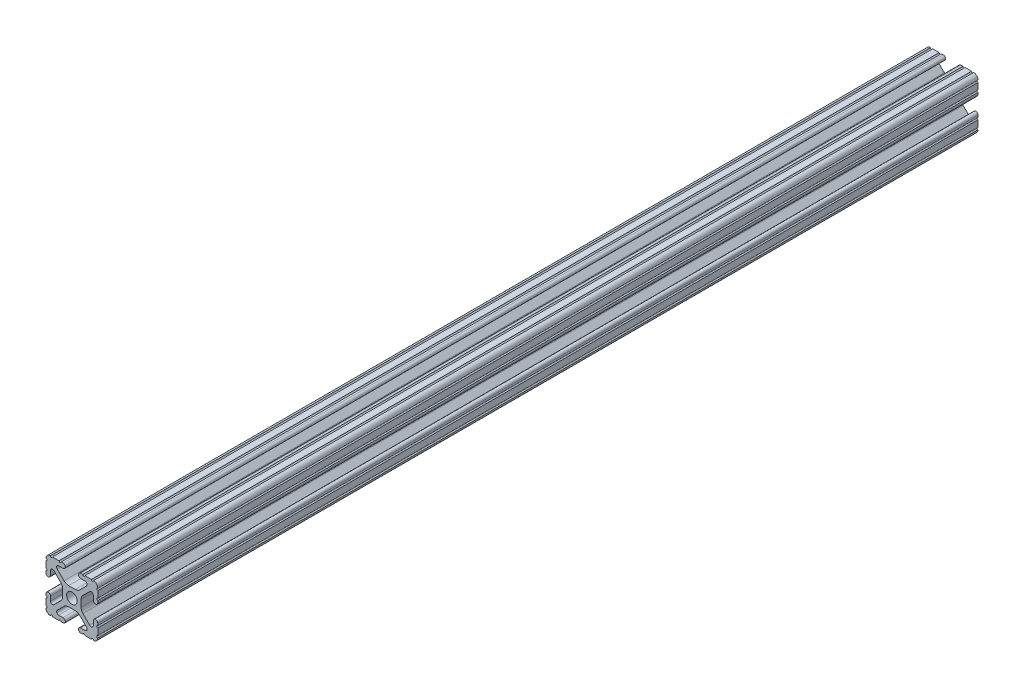
from build123d import *

# Parameters (mm, degrees)
SKETCH1_R           = 2.6035
BOSS_EXTRUDE1_DEPTH = 1270
SKETCH6_W           = 122.666969327
SKETCH6_H           = 109.347800906
CUT_EXTRUDE1_DEPTH  = 699.730870937
SKETCH7_W           = 29.67741712
SKETCH7_H           = 27.72917189
CUT_EXTRUDE2_DEPTH  = 266.7


with BuildPart() as part:
    # Sketch1 → Boss-Extrude1 (new body)
    with BuildSketch(Plane(origin=(0, 0, -1270), x_dir=(-1, 0, 0), z_dir=(0, 0, -1))):
        with BuildLine():
            Line((12.7, -9.5504), (12.7, -6.3330836))
            ThreePointArc((12.7, -6.3330836), (12.192, -5.8250836), (12.7, -5.3170836))
            Line((12.7, -5.3170836), (12.7, -4.3434))
            ThreePointArc((12.7, -4.3434), (11.5951, -3.2385), (10.4902, -4.3434))
            Line((10.4902, -4.3434), (10.4902, -6.474794456))
            ThreePointArc((10.4902, -6.474794456), (9.863006367, -7.413456061), (8.75577951, -7.193214945))
            Line((8.75577951, -7.193214945), (5.42573597, -3.863171405))
            ThreePointArc((5.42573597, -3.863171405), (4.737482484, -2.833127272), (4.4958, -1.618107374))
            Line((4.4958, -1.618107374), (4.4958, 1.618107374))
            ThreePointArc((4.4958, 1.618107374), (4.737482484, 2.833127272), (5.42573597, 3.863171405))
            Line((5.42573597, 3.863171405), (8.75577951, 7.193214945))
            ThreePointArc((8.75577951, 7.193214945), (9.863006367, 7.413456061), (10.4902, 6.474794456))
            Line((10.4902, 6.474794456), (10.4902, 4.343399971))
            ThreePointArc((10.4902, 4.343399971), (11.5951, 3.238499971), (12.7, 4.343399971))
            Line((12.7, 4.343399971), (12.7, 5.3170836))
            ThreePointArc((12.7, 5.3170836), (12.192, 5.8250836), (12.7, 6.3330836))
            Line((12.7, 6.3330836), (12.7, 9.5504))
            ThreePointArc((12.7, 9.5504), (12.192000006, 10.058323491), (12.699846982, 10.566399977))
            ThreePointArc((12.699846982, 10.566399977), (12.082522516, 12.082522516), (10.566399977, 12.699846982))
            ThreePointArc((10.566399977, 12.699846982), (10.058323491, 12.192000006), (9.5504, 12.7))
            Line((9.5504, 12.7), (6.3330836, 12.7))
            ThreePointArc((6.3330836, 12.7), (5.8250836, 12.192), (5.3170836, 12.7))
            Line((5.3170836, 12.7), (4.3434, 12.7))
            ThreePointArc((4.3434, 12.7), (3.2385, 11.5951), (4.3434, 10.4902))
            Line((4.3434, 10.4902), (6.474794456, 10.4902))
            ThreePointArc((6.474794456, 10.4902), (7.413456061, 9.863006367), (7.193214945, 8.75577951))
            Line((7.193214945, 8.75577951), (3.863171405, 5.42573597))
            ThreePointArc((3.863171405, 5.42573597), (2.833127272, 4.737482484), (1.618107374, 4.4958))
            Line((1.618107374, 4.4958), (-1.618107374, 4.4958))
            ThreePointArc((-1.618107374, 4.4958), (-2.833127272, 4.737482484), (-3.863171405, 5.42573597))
            Line((-3.863171405, 5.42573597), (-7.193214945, 8.75577951))
            ThreePointArc((-7.193214945, 8.75577951), (-7.413456061, 9.863006367), (-6.474794456, 10.4902))
            Line((-6.474794456, 10.4902), (-4.343399971, 10.4902))
            ThreePointArc((-4.343399971, 10.4902), (-3.238499971, 11.5951), (-4.343399971, 12.7))
            Line((-4.343399971, 12.7), (-5.3170836, 12.7))
            ThreePointArc((-5.3170836, 12.7), (-5.8250836, 12.192), (-6.3330836, 12.7))
            Line((-6.3330836, 12.7), (-9.5504, 12.7))
            ThreePointArc((-9.5504, 12.7), (-10.058323491, 12.192000006), (-10.566399977, 12.699846982))
            ThreePointArc((-10.566399977, 12.699846982), (-12.082522516, 12.082522516), (-12.699846982, 10.566399977))
            ThreePointArc((-12.699846982, 10.566399977), (-12.192000006, 10.058323491), (-12.7, 9.5504))
            Line((-12.7, 9.5504), (-12.7, 6.3330836))
            ThreePointArc((-12.7, 6.3330836), (-12.192, 5.8250836), (-12.7, 5.3170836))
            Line((-12.7, 5.3170836), (-12.7, 4.3434))
            ThreePointArc((-12.7, 4.3434), (-11.5951, 3.2385), (-10.4902, 4.3434))
            Line((-10.4902, 4.3434), (-10.4902, 6.474794456))
            ThreePointArc((-10.4902, 6.474794456), (-9.863006367, 7.413456061), (-8.75577951, 7.193214945))
            Line((-8.75577951, 7.193214945), (-5.42573597, 3.863171405))
            ThreePointArc((-5.42573597, 3.863171405), (-4.737482484, 2.833127272), (-4.4958, 1.618107374))
            Line((-4.4958, 1.618107374), (-4.4958, -1.618107374))
            ThreePointArc((-4.4958, -1.618107374), (-4.737482484, -2.833127272), (-5.42573597, -3.863171405))
            Line((-5.42573597, -3.863171405), (-8.75577951, -7.193214945))
            ThreePointArc((-8.75577951, -7.193214945), (-9.863006367, -7.413456061), (-10.4902, -6.474794456))
            Line((-10.4902, -6.474794456), (-10.4902, -4.343399971))
            ThreePointArc((-10.4902, -4.343399971), (-11.5951, -3.238499971), (-12.7, -4.343399971))
            Line((-12.7, -4.343399971), (-12.7, -5.3170836))
            ThreePointArc((-12.7, -5.3170836), (-12.192, -5.8250836), (-12.7, -6.3330836))
            Line((-12.7, -6.3330836), (-12.7, -9.5504))
            ThreePointArc((-12.7, -9.5504), (-12.192000006, -10.058323491), (-12.699846982, -10.566399977))
            ThreePointArc((-12.699846982, -10.566399977), (-12.082522516, -12.082522516), (-10.566399977, -12.699846982))
            ThreePointArc((-10.566399977, -12.699846982), (-10.058323491, -12.192000006), (-9.5504, -12.7))
            Line((-9.5504, -12.7), (-6.3330836, -12.7))
            ThreePointArc((-6.3330836, -12.7), (-5.8250836, -12.192), (-5.3170836, -12.7))
            Line((-5.3170836, -12.7), (-4.3434, -12.7))
            ThreePointArc((-4.3434, -12.7), (-3.2385, -11.5951), (-4.3434, -10.4902))
            Line((-4.3434, -10.4902), (-6.474794456, -10.4902))
            ThreePointArc((-6.474794456, -10.4902), (-7.413456061, -9.863006367), (-7.193214945, -8.75577951))
            Line((-7.193214945, -8.75577951), (-3.863171405, -5.42573597))
            ThreePointArc((-3.863171405, -5.42573597), (-2.833127272, -4.737482484), (-1.618107374, -4.4958))
            Line((-1.618107374, -4.4958), (1.618107374, -4.4958))
            ThreePointArc((1.618107374, -4.4958), (2.833127272, -4.737482484), (3.863171405, -5.42573597))
            Line((3.863171405, -5.42573597), (7.193214945, -8.75577951))
            ThreePointArc((7.193214945, -8.75577951), (7.413456061, -9.863006367), (6.474794456, -10.4902))
            Line((6.474794456, -10.4902), (4.343399971, -10.4902))
            ThreePointArc((4.343399971, -10.4902), (3.238499971, -11.5951), (4.343399971, -12.7))
            Line((4.343399971, -12.7), (5.3170836, -12.7))
            ThreePointArc((5.3170836, -12.7), (5.8250836, -12.192), (6.3330836, -12.7))
            Line((6.3330836, -12.7), (9.5504, -12.7))
            ThreePointArc((9.5504, -12.7), (10.058323491, -12.192000006), (10.566399977, -12.699846982))
            ThreePointArc((10.566399977, -12.699846982), (12.082522516, -12.082522516), (12.699846982, -10.566399977))
            ThreePointArc((12.699846982, -10.566399977), (12.192000006, -10.058323491), (12.7, -9.5504))
        make_face()
        Circle(SKETCH1_R, mode=Mode.SUBTRACT)
    extrude(amount=-BOSS_EXTRUDE1_DEPTH)

    # Sketch6 → Cut-Extrude1 (cut, through all)
    with BuildSketch(Plane(origin=(0, 0, -698.5), x_dir=(-1, 0, 0), z_dir=(0, 0, -1))):
        with Locations((17.668938213, -20.549718265)):
            Rectangle(SKETCH6_W, SKETCH6_H)
    extrude(amount=CUT_EXTRUDE1_DEPTH, mode=Mode.SUBTRACT)

    # Sketch7 → Cut-Extrude2 (cut)
    with BuildSketch(Plane.XY):
        Rectangle(SKETCH7_W, SKETCH7_H)
    extrude(amount=-CUT_EXTRUDE2_DEPTH, mode=Mode.SUBTRACT)


solid = part.part
